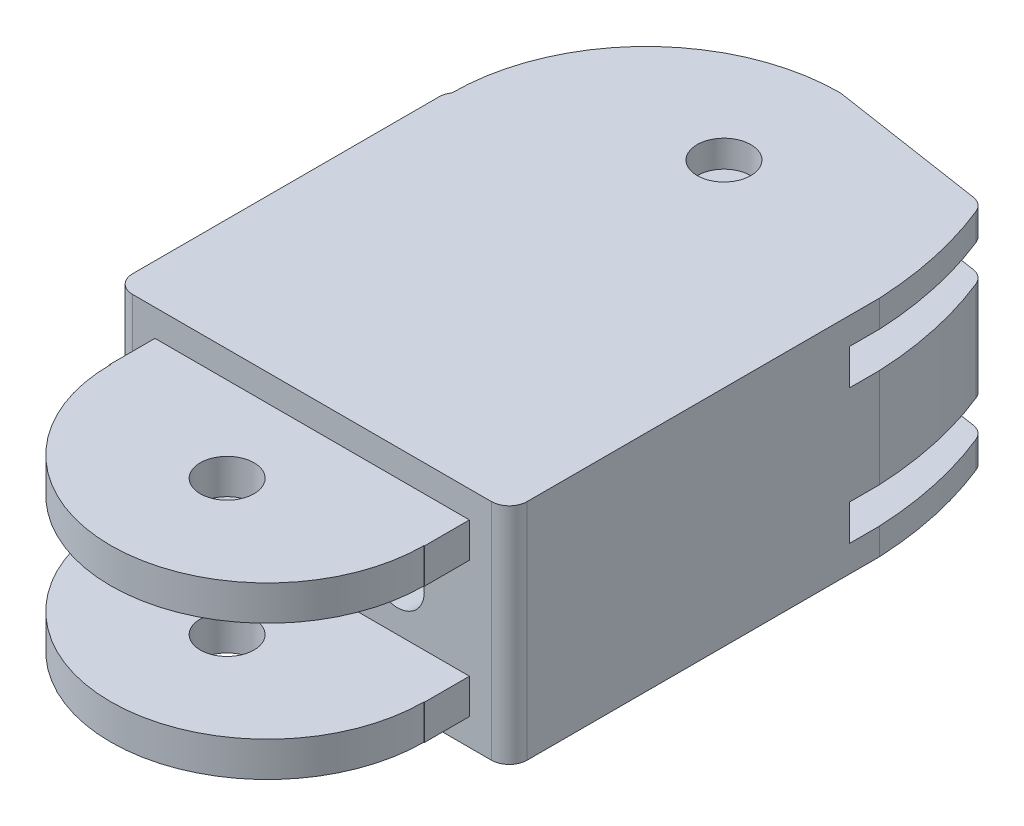
from build123d import *

# Parameters (mm, degrees)
SKETCH2_W             = 17.554431489
SKETCH2_H             = 1.95
BOSS_EXTRUDE1_DEPTH   = 8.75
BOSS_EXTRUDE1_2_DEPTH = 8.75
CUT_EXTRUDE1_DEPTH    = 26.518349076
SKETCH4_W             = 22.027215745
SKETCH4_H             = 12.505427167
BOSS_EXTRUDE2_DEPTH   = 32
SKETCH5_R             = 1.5
CUT_EXTRUDE2_DEPTH    = 12
SKETCH6_W             = 22.027215745
SKETCH6_H             = 12.505427167
SKETCH6_W_2           = 17.554431489
SKETCH6_H_2           = 1.95
CUT_EXTRUDE3_DEPTH    = 2.5
SKETCH7_R             = 1.5
CUT_EXTRUDE4_DEPTH    = 13
SKETCH8_R             = 1.5
CUT_EXTRUDE5_DEPTH    = 28
FILLET3_R             = 1
SKETCH9_W             = 22.02721574
SKETCH9_H             = 2
CUT_EXTRUDE6_DEPTH    = 11


with BuildPart() as part:
    # Sketch2 → Boss-Extrude1 (new body)
    with BuildSketch(Plane.XY):
        with Locations((-13.228930986, -27.845183414)):
            Rectangle(SKETCH2_W, SKETCH2_H)
    extrude(amount=BOSS_EXTRUDE1_DEPTH)


with BuildPart() as body_2:
    # Sketch2 → Boss-Extrude1 2 (new body)
    with BuildSketch(Plane.XY):
        with Locations((-13.228930986, -20.289756247)):
            Rectangle(SKETCH2_W, SKETCH2_H)
    extrude(amount=BOSS_EXTRUDE1_2_DEPTH)


with BuildPart() as cut_extrude1_tool:
    # Sketch3 → Cut-Extrude1 (new, through all)
    with BuildSketch(Plane(origin=(0, -19.314756247, 0), x_dir=(1, 0, 0), z_dir=(0, 1, 0))):
        with BuildLine():
            ThreePointArc((-13.228930986, -8.75), (-7.041746651, -6.187184335), (-4.478930986, 0))
            add(Edge.make_bspline(
                [(-4.478930986, 0), (1.138349918, -4.151657709), (-4.451715242, -8.75)],
                knots=[0, 0, 0, 1, 1, 1], degree=2))
            add(Edge.make_bspline(
                [(-22.006146731, -8.75), (-13.228930986, -12.473510392), (-4.451715242, -8.75)],
                knots=[0, 0, 0, 1, 1, 1], degree=2))
            add(Edge.make_bspline(
                [(-21.978930986, 0), (-25.926969228, -4.242865138), (-22.006146731, -8.75)],
                knots=[0, 0, 0, 1, 1, 1], degree=2))
            ThreePointArc((-21.978930986, 0), (-19.416115322, -6.187184335), (-13.228930986, -8.75))
        make_face()
    extrude(amount=-CUT_EXTRUDE1_DEPTH)


with BuildPart() as part_1:
    add(part.part)

    # Cut-Extrude1: cut by cut_extrude1_tool
    add(cut_extrude1_tool.part, mode=Mode.SUBTRACT)



with BuildPart() as body_2_1:
    add(body_2.part)

    # Cut-Extrude1: cut by cut_extrude1_tool
    add(cut_extrude1_tool.part, mode=Mode.SUBTRACT)


with BuildPart() as part_2:
    add(part_1.part)

    add(body_2_1.part)  # Boss-Extrude2 merges body 2
    # Sketch4 → Boss-Extrude2 (add)
    with BuildSketch(Plane(origin=(0, 0, 0), x_dir=(-1, 0, 0), z_dir=(0, 0, -1))):
        with Locations((13.242538859, -24.067469831)):
            Rectangle(SKETCH4_W, SKETCH4_H)
    extrude(amount=BOSS_EXTRUDE2_DEPTH)

    # Sketch5 → Cut-Extrude2 (cut)
    with BuildSketch(Plane(origin=(0, -19.314756247, 0), x_dir=(1, 0, 0), z_dir=(0, 1, 0))):
        with Locations(Location((-13.228930986, -2.25, 0), (0, 0, 270))):
            Circle(SKETCH5_R)
    extrude(amount=-CUT_EXTRUDE2_DEPTH, mode=Mode.SUBTRACT)

    # Sketch6 → Cut-Extrude3 (cut)
    with BuildSketch(Plane.XY):
        with Locations((-13.242538859, -24.067469831)):
            Rectangle(SKETCH6_W, SKETCH6_H)
        with Locations((-13.228930986, -27.845183414)):
            Rectangle(SKETCH6_W_2, SKETCH6_H_2, mode=Mode.SUBTRACT)
        with Locations((-13.228930986, -20.289756247)):
            Rectangle(SKETCH6_W_2, SKETCH6_H_2, mode=Mode.SUBTRACT)
    extrude(amount=-CUT_EXTRUDE3_DEPTH, mode=Mode.SUBTRACT)

    # Sketch7 → Cut-Extrude4 (cut)
    with BuildSketch(Plane(origin=(0, -17.814756247, 0), x_dir=(1, 0, 0), z_dir=(0, 1, 0))):
        with Locations(Location((-13.242538859, 25.5, 0), (0, 0, 270))):
            Circle(SKETCH7_R)
        with BuildLine():
            Line((-24.086865874, 21.155672985), (-24.256146731, 21.155672985))
            add(Edge.make_bspline(
                [(-2.228930986, 21.155672985), (11.471530889, 27.189710441), (-11.765166974, 53.431279988), (-37.007876173, 21.523583672), (-24.256146731, 21.155672985)],
                knots=[0, 0, 0, 0, 0.52011282, 1, 1, 1, 1], degree=3))
            add(Edge.make_bspline(
                [(-3.948545621, 30.585343246), (-2.007113924, 26.093685314), (-2.228930986, 21.155672985)],
                knots=[0, 0, 0, 1, 1, 1], degree=2))
            Line((-3.948545621, 30.585343246), (-13.242538859, 32))
            ThreePointArc((-13.242538859, 32), (-20.910636028, 28.823770155), (-24.086865874, 21.155672985))
        make_face()
    extrude(amount=-CUT_EXTRUDE4_DEPTH, mode=Mode.SUBTRACT)

    # Sketch8 → Cut-Extrude5 (cut)
    with BuildSketch(Plane.XY.offset(-2.5)):
        with Locations((-18.011106811, -24.06746983)):
            Circle(SKETCH8_R)
        with Locations((-8.473970906, -24.06746983)):
            Circle(SKETCH8_R)
    extrude(amount=-CUT_EXTRUDE5_DEPTH, mode=Mode.SUBTRACT)

    # Fillet3
    # the kernel refuses this fillet: 1 mm, written as the material it takes off along each edge
    with BuildSketch(Plane(origin=(-24.256146731, -15.314756247, -2.5), x_dir=(1, 0, 0), z_dir=(0, -1, 0))) as fillet3_piece_1:
        with BuildLine():
            CenterArc((FILLET3_R, -FILLET3_R), FILLET3_R, 90, 90)
            Line((0, -FILLET3_R), (-FILLET3_R * 0.02, -FILLET3_R))
            Line((-FILLET3_R * 0.02, -FILLET3_R), (-FILLET3_R * 0.02, FILLET3_R * 0.02))
            Line((-FILLET3_R * 0.02, FILLET3_R * 0.02), (FILLET3_R, FILLET3_R * 0.02))
            Line((FILLET3_R, FILLET3_R * 0.02), (FILLET3_R, 0))
        make_face()
    extrude(amount=17.505427167, mode=Mode.SUBTRACT)
    with BuildSketch(Plane(origin=(-24.256146731, -16.423026869, -21.155672985), x_dir=(0, 0, 1), z_dir=(0, -1, 0))) as fillet3_piece_2:
        with BuildLine():
            CenterArc((0.556691751, -1), FILLET3_R, 90, 33.827317624)
            Line((0, -0.169280857), (-0.011133835, -0.152666474))
            ThreePointArc((-0.011133835, -0.152666474), (-0.02, -0.084640429), (-0.02, 0))
            Line((-0.02, 0), (0, 0.02))
            Line((0, 0.02), (0.556691751, 0.02))
            Line((0.556691751, 0.02), (0.556691751, 0))
        make_face()
    extrude(amount=15.288885922, mode=Mode.SUBTRACT)
    with BuildSketch(Plane(origin=(-2.228930986, -32.820183414, -2.5), x_dir=(0, 0, -1), z_dir=(0, 1, 0))) as fillet3_piece_3:
        with BuildLine():
            CenterArc((FILLET3_R, FILLET3_R), FILLET3_R, 180, 90)
            Line((0, FILLET3_R), (-FILLET3_R * 0.02, FILLET3_R))
            Line((-FILLET3_R * 0.02, FILLET3_R), (-FILLET3_R * 0.02, -FILLET3_R * 0.02))
            Line((-FILLET3_R * 0.02, -FILLET3_R * 0.02), (FILLET3_R, -FILLET3_R * 0.02))
            Line((FILLET3_R, -FILLET3_R * 0.02), (FILLET3_R, 0))
        make_face()
    extrude(amount=17.505427167, mode=Mode.SUBTRACT)
    with BuildSketch(Plane(origin=(-3.948545621, -16.375444783, -30.585343246), x_dir=(-0.9886132451058307, 0, -0.1504787413600958), z_dir=(0, -1, 0))) as fillet3_piece_4:
        with BuildLine():
            CenterArc((0.562435527, -1), FILLET3_R, 90, 59.471323616)
            Line((-0.298939504, -0.492030458), (-0.316167005, -0.481871067))
            ThreePointArc((-0.316167005, -0.481871067), (-0.168173949, -0.234650824), (-0.016955383, 0.010607308))
            Line((-0.016955383, 0.010607308), (0, 0.02))
            Line((0, 0.02), (0.562435527, 0.02))
            Line((0.562435527, 0.02), (0.562435527, 0))
        make_face()
    extrude(amount=15.384050094, mode=Mode.SUBTRACT)

    # Sketch9 → Cut-Extrude6 (cut)
    with BuildSketch(Plane.XY.offset(-32.5)):
        with Locations((-13.24253886, -20.31475625)):
            Rectangle(SKETCH9_W, SKETCH9_H)
        with Locations((-13.24253886, -27.836055834)):
            Rectangle(SKETCH9_W, SKETCH9_H)
    extrude(amount=CUT_EXTRUDE6_DEPTH, mode=Mode.SUBTRACT)


solid = part_2.part
